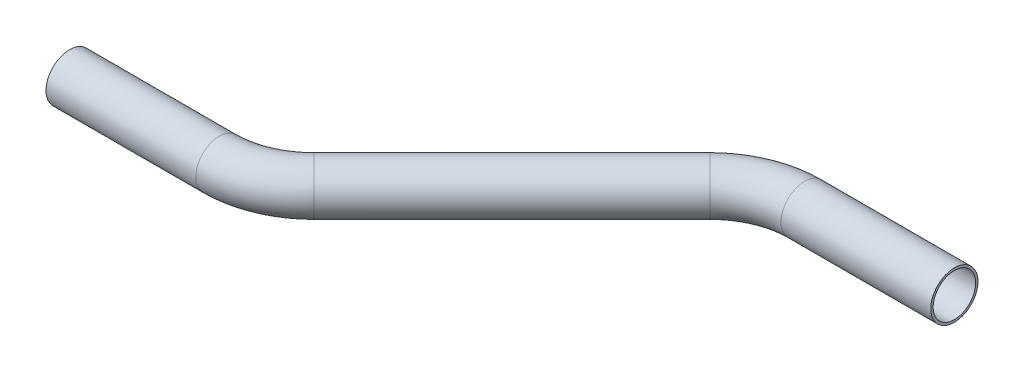
from build123d import *

# Parameters (mm, degrees)
SKETCH2_R   = 6.35
SKETCH2_R_2 = 5.715


with BuildPart() as part:
    # Sweep1: sweep along a path in Sketch1
    with BuildLine(Plane(origin=(0, 0, 0), x_dir=(1, 0, 0), z_dir=(0, 1, 0))) as sweep1_path:
        Line((0, 0), (40.278975516, 0))
        ThreePointArc((40.278975516, 0), (49.999134698, 1.933459874), (58.239487758, 7.439487758))
        Line((58.239487758, 7.439487758), (111.516653654, 60.716653654))
        ThreePointArc((111.516653654, 60.716653654), (119.757006714, 66.222681537), (129.477165896, 68.156141412))
        Line((129.477165896, 68.156141412), (169.756141412, 68.156141412))
    # Sketch2 → Sweep1 (sweep)
    with BuildSketch(Plane(origin=(0, 0, 0), x_dir=(0, 0, -1), z_dir=(1, 0, 0))):
        Circle(SKETCH2_R)
        Circle(SKETCH2_R_2, mode=Mode.SUBTRACT)
    sweep(path=sweep1_path.line)


solid = part.part
